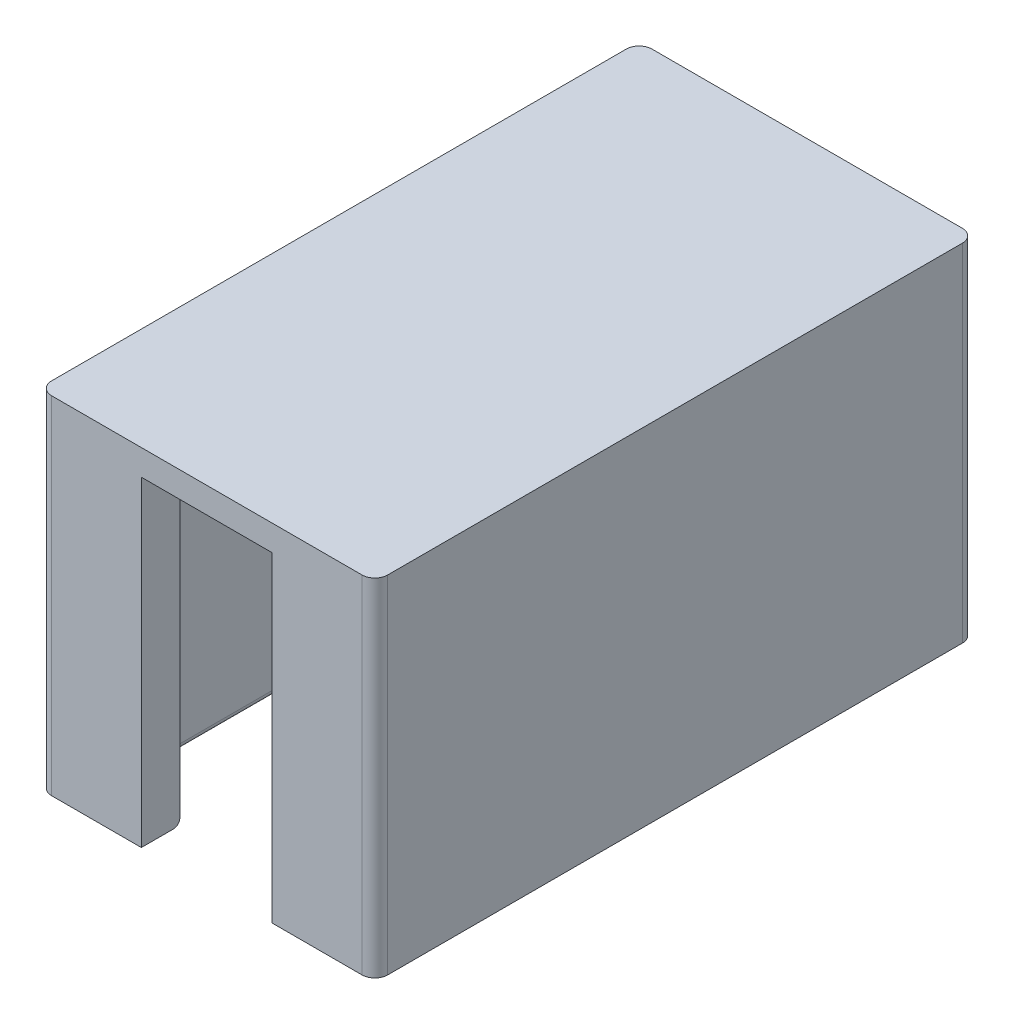
from build123d import *

# Parameters (mm, degrees)
SKETCH1_W           = 26.2
SKETCH1_H           = 46.8
SKETCH1_W_2         = 20.2
SKETCH1_H_2         = 40.8
BOSS_EXTRUDE1_DEPTH = 25
SKETCH3_W           = 10.2
SKETCH3_H           = 25
CUT_EXTRUDE1_DEPTH  = 10
FILLET1_R           = 0.5
SKETCH4_W           = 26.2
SKETCH4_H           = 46.8
BOSS_EXTRUDE2_DEPTH = 2
FILLET2_R           = 1
SKETCH5_W           = 10.2
SKETCH5_H           = 24.5
CUT_EXTRUDE3_DEPTH  = 5


with BuildPart() as part:
    # Sketch1 → Boss-Extrude1 (new body)
    with BuildSketch(Plane(origin=(0, 0, 0), x_dir=(1, 0, 0), z_dir=(0, 1, 0))):
        with Locations((13.1, 23.4)):
            Rectangle(SKETCH1_W, SKETCH1_H)
        with Locations((13.1, 23.4)):
            Rectangle(SKETCH1_W_2, SKETCH1_H_2, mode=Mode.SUBTRACT)
    extrude(amount=BOSS_EXTRUDE1_DEPTH)

    # Sketch3 → Cut-Extrude1 (cut)
    with BuildSketch(Plane.XY):
        with Locations((13.1, 12.5)):
            Rectangle(SKETCH3_W, SKETCH3_H)
    extrude(amount=-CUT_EXTRUDE1_DEPTH, mode=Mode.SUBTRACT)

    # Fillet1
    fillet1_edges = [part.edges().sort_by_distance(p)[0] for p in [
        (5.5, 25, -3),
        (3, 25, -23.4),
        (13.1, 25, -43.8),
        (20.7, 25, -3),
        (23.2, 25, -23.4),
        (5.5, 0, -3),
        (3, 0, -23.4),
        (13.1, 0, -43.8),
        (23.2, 0, -23.4),
        (20.7, 0, -3),
    ]]
    fillet(fillet1_edges, radius=FILLET1_R)

    # Sketch4 → Boss-Extrude2 (add)
    with BuildSketch(Plane(origin=(0, 25, 0), x_dir=(1, 0, 0), z_dir=(0, 1, 0))):
        with Locations((13.1, 23.4)):
            Rectangle(SKETCH4_W, SKETCH4_H)
    extrude(amount=BOSS_EXTRUDE2_DEPTH)

    # Fillet2
    fillet2_edges = [part.edges().sort_by_distance(p)[0] for p in [
        (26.2, 13.5, -46.8),
        (0, 13.5, -46.8),
        (26.2, 13.5, 0),
        (0, 13.5, 0),
    ]]
    fillet(fillet2_edges, radius=FILLET2_R)

    # Sketch5 → Cut-Extrude3 (cut)
    with BuildSketch(Plane(origin=(0, 0, -46.8), x_dir=(-1, 0, 0), z_dir=(0, 0, -1))):
        with Locations((-13.1, 12.25)):
            Rectangle(SKETCH5_W, SKETCH5_H)
    extrude(amount=-CUT_EXTRUDE3_DEPTH, mode=Mode.SUBTRACT)


solid = part.part
